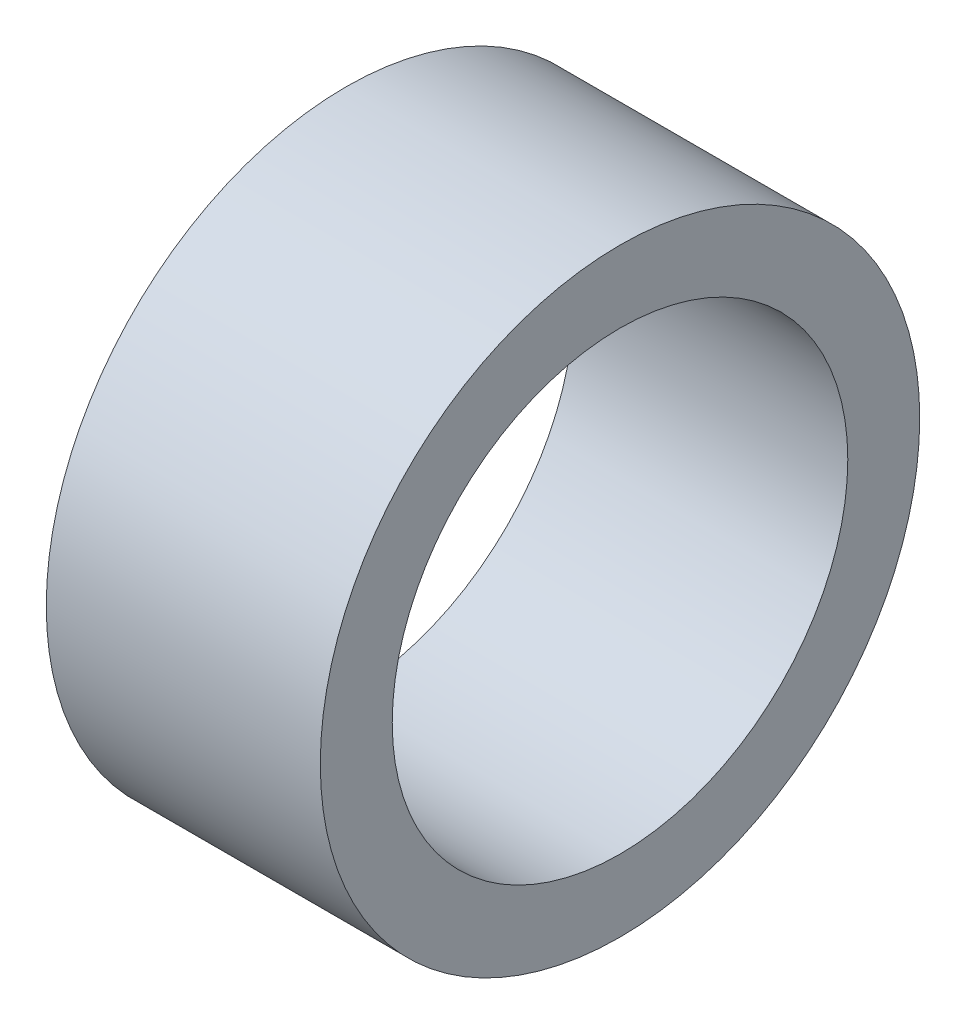
from build123d import *

# Parameters (mm, degrees)
SKETCH1_W = 5.08
SKETCH1_H = 1.3335


with BuildPart() as part:
    # Sketch1 → Revolve1 (revolve)
    with BuildSketch(Plane.XY):
        with Locations((34.29, 4.8895)):
            Rectangle(SKETCH1_W, SKETCH1_H)
    revolve(axis=Axis((0, 0, 0), (1, 0, 0)))


solid = part.part
